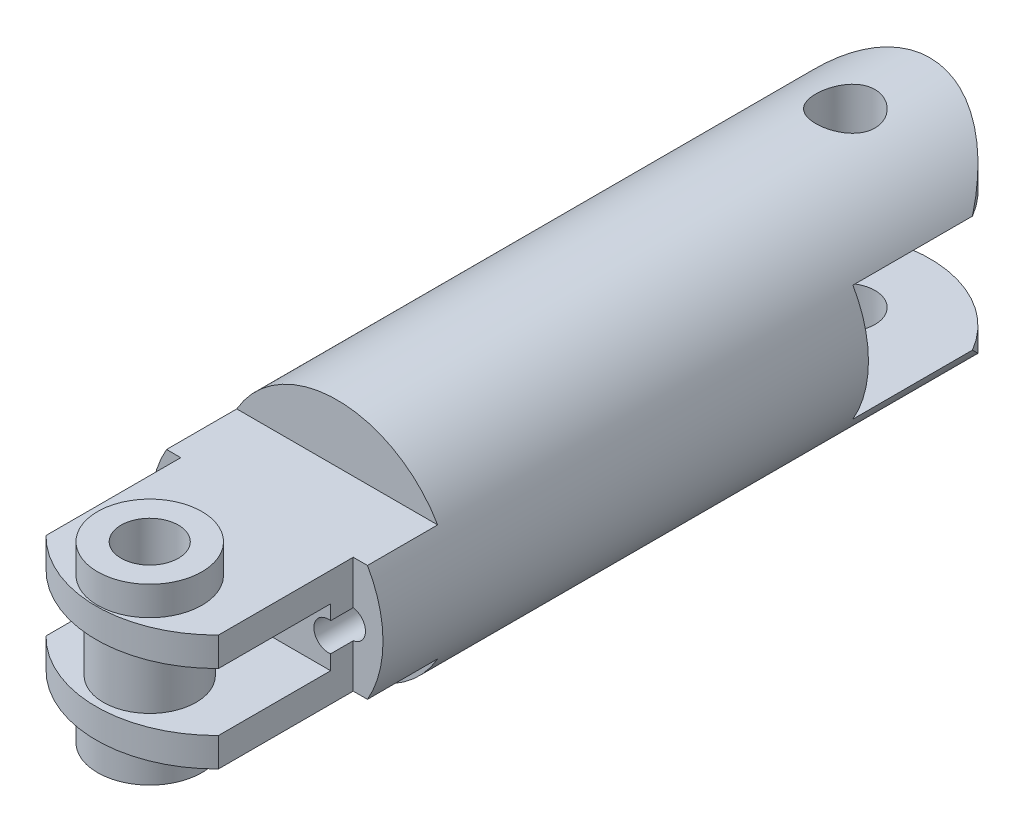
from build123d import *
from build123d.topology import SkipClean

# Parameters (mm, degrees)
SKETCH2_R                       = 10
PHALANGE_LENGTH_DEPTH           = 43.8
BOSS_EXTRUDE3_DEPTH             = 5
BOSS_EXTRUDE4_DEPTH             = 5
BOSS_EXTRUDE4_DEPTH_BACK        = 5
CUT_EXTRUDE2_START              = -15.3025
CUT_EXTRUDE2_DEPTH              = 15.3025
SKETCH7_R                       = 1.65
CUT_EXTRUDE3_DEPTH              = 10
CUT_EXTRUDE4_DEPTH              = 2.5
CUT_EXTRUDE4_DEPTH_BACK         = 2.5
CUT_EXTRUDE7_REACH              = 63.838
SKETCH4_R                       = 1.65
CUT_EXTRUDE7_DIRECTION_2_REACH  = 63.838
CUT_EXTRUDE_THIN1_START         = 43.8
CUT_EXTRUDE_THIN1_DEPTH         = 10.361670454
BOSS_EXTRUDE5_REACH             = 63.28
SKETCH9_R                       = 4
SKETCH9_R_2                     = 1.65
CUT_EXTRUDE8_REACH              = 62.771
SKETCH10_R                      = 1.25
CUT_EXTRUDE9_START              = -8
CUT_EXTRUDE9_DEPTH              = 8
CUT_EXTRUDE10_REACH             = 63.28
CUT_EXTRUDE10_DIRECTION_2_REACH = 63.28
CUT_EXTRUDE11_START             = -10
CUT_EXTRUDE11_OUTLINE_W         = 2.565773848
CUT_EXTRUDE11_OUTLINE_H         = 11.6166929
CUT_EXTRUDE11_DEPTH             = 10
BOSS_EXTRUDE6_START             = 7.5
SKETCH14_R                      = 4.5
SKETCH14_R_2                    = 1.65
BOSS_EXTRUDE6_DEPTH             = 2.5
BOSS_EXTRUDE7_START             = -7.5
SKETCH14_2_R                    = 4.5
SKETCH14_2_R_2                  = 1.65
BOSS_EXTRUDE7_DEPTH             = 2.5
SCALE1_SCALE                    = 0.666666667
CUT_EXTRUDE12_START             = -11.666667
SKETCH15_R                      = 1.65
CUT_EXTRUDE12_DEPTH             = 13.333339
CUT_EXTRUDE13_REACH             = 47.962
SKETCH16_R                      = 1.7
CUT_EXTRUDE13_DIRECTION_2_REACH = 47.962


# Read off the part's stored shape, not the designer's step: Cut-Extrude-Thin1, Cut-Extrude11
with BuildPart() as part:
    # Sketch2 → Phalange Length (new body)
    with BuildSketch(Plane.XY):
        Circle(SKETCH2_R)
    extrude(amount=PHALANGE_LENGTH_DEPTH)

    # Sketch3 → Boss-Extrude3 (add)
    with BuildSketch(Plane(origin=(0, -10, 0), x_dir=(-1, 0, 0), z_dir=(0, -1, 0))):
        with BuildLine():
            Line((-10, 5.302499701), (-10, 0))
            Line((-10, 0), (10, 0))
            Line((10, 0), (10, 5.302499701))
            ThreePointArc((10, 5.302499701), (0, 15.302499701), (-10, 5.302499701))
        make_face()
    boss_extrude3 = extrude(amount=-BOSS_EXTRUDE3_DEPTH)

    # Mirror1: Boss-Extrude3 across plane
    add(boss_extrude3.mirror(Plane.ZX))

    # Sketch5 → Boss-Extrude4 (add, two sides: drawn at the far end of the back side and taken through both)
    with BuildSketch(Plane(origin=(0, 0, 0), x_dir=(1, 0, 0), z_dir=(0, 1, 0)).offset(-BOSS_EXTRUDE4_DEPTH_BACK)):
        with BuildLine():
            Line((-10, -49.583157911), (-10, -43.8))
            Line((-10, -43.8), (10, -43.8))
            Line((10, -43.8), (10, -49.583157911))
            ThreePointArc((10, -49.583157911), (0, -59.151984156), (-10, -49.583157911))
        make_face()
    extrude(amount=BOSS_EXTRUDE4_DEPTH + BOSS_EXTRUDE4_DEPTH_BACK)

    # Sketch6 → Cut-Extrude2 (cut)
    with SkipClean():  # the faces are left unmerged after this step: merging them gives an invalid solid
        with BuildSketch(Plane.XY.offset(CUT_EXTRUDE2_START)):
            with BuildLine():
                ThreePointArc((0, 10), (5, 8.660254038), (8.660254038, 5))
                Line((8.660254038, 5), (10, 5))
                Line((10, 5), (10, 10))
                Line((10, 10), (0, 10))
            make_face()
            with BuildLine():
                Line((10, -5), (8.660254038, -5))
                ThreePointArc((8.660254038, -5), (5, -8.660254038), (0, -10))
                Line((0, -10), (10, -10))
                Line((10, -10), (10, -5))
            make_face()
            with BuildLine():
                ThreePointArc((-8.660254038, 5), (-5, 8.660254038), (0, 10))
                Line((0, 10), (-10, 10))
                Line((-10, 10), (-10, 5))
                Line((-10, 5), (-8.660254038, 5))
            make_face()
            with BuildLine():
                Line((-10, -10), (0, -10))
                ThreePointArc((0, -10), (-5, -8.660254038), (-8.660254038, -5))
                Line((-8.660254038, -5), (-10, -5))
                Line((-10, -5), (-10, -10))
            make_face()
        extrude(amount=CUT_EXTRUDE2_DEPTH, mode=Mode.SUBTRACT)

    # Sketch7 → Cut-Extrude3 (cut)
    with SkipClean():  # the faces are left unmerged after this step: merging them gives an invalid solid
        with BuildSketch(Plane(origin=(0, 5, 0), x_dir=(1, 0, 0), z_dir=(0, 1, 0))):
            with Locations(Location((0, -51.961984156, 0), (0, 0, 270))):
                Circle(SKETCH7_R)
        extrude(amount=-CUT_EXTRUDE3_DEPTH, mode=Mode.SUBTRACT)

    # Sketch5<2> → Cut-Extrude4 (cut, two sides: drawn at the far end of the back side and taken through both)
    with BuildSketch(Plane(origin=(0, 0, 0), x_dir=(1, 0, 0), z_dir=(0, 1, 0)).offset(-CUT_EXTRUDE4_DEPTH_BACK)):
        with BuildLine():
            Line((-10, -49.583157911), (-10, -43.8))
            Line((-10, -43.8), (10, -43.8))
            Line((10, -43.8), (10, -49.583157911))
            ThreePointArc((10, -49.583157911), (0, -59.151984156), (-10, -49.583157911))
        make_face()
    extrude(amount=CUT_EXTRUDE4_DEPTH + CUT_EXTRUDE4_DEPTH_BACK, mode=Mode.SUBTRACT)

    # Sketch4 → Cut-Extrude7 (cut, up to next)
    with BuildSketch(Plane(origin=(0, -5, 0), x_dir=(1, 0, 0), z_dir=(0, 1, 0)), mode=Mode.PRIVATE) as cut_extrude7_sk1:
        with Locations(Location((0, 8.010159673, 0), (0, 0, 270))):
            Circle(SKETCH4_R)
    cut_extrude7_tool1 = extrude(cut_extrude7_sk1.sketch, amount=-CUT_EXTRUDE7_REACH, mode=Mode.PRIVATE) & part.part
    add(cut_extrude7_tool1.solids().sort_by_distance((0, -5, -8.01016))[0], mode=Mode.SUBTRACT)

    # Sketch4 → Cut-Extrude7 direction 2 (cut, up to next)
    with BuildSketch(Plane(origin=(0, -5, 0), x_dir=(1, 0, 0), z_dir=(0, 1, 0)), mode=Mode.PRIVATE) as cut_extrude7_direction_2_sk1:
        with Locations(Location((0, 8.010159673, 0), (0, 0, 270))):
            Circle(SKETCH4_R)
    cut_extrude7_direction_2_tool1 = extrude(cut_extrude7_direction_2_sk1.sketch, amount=CUT_EXTRUDE7_DIRECTION_2_REACH, mode=Mode.PRIVATE) & part.part
    add(cut_extrude7_direction_2_tool1.solids().sort_by_distance((0, -5, -8.01016))[0], mode=Mode.SUBTRACT)

    # Cut-Extrude-Thin1 outline → Cut-Extrude-Thin1 (cut)
    with SkipClean():  # the faces are left unmerged after this step: merging them gives an invalid solid
        with BuildSketch(Plane.XY.offset(CUT_EXTRUDE_THIN1_START)):
            with BuildLine():
                ThreePointArc((8.660254038, 5), (9.256147934, 3.78466979), (9.682458366, 2.5))
                Line((9.682458366, 2.5), (10, 2.5))
                Line((10, 2.5), (10, 5))
                Line((10, 5), (8.660254038, 5))
            make_face()
            with BuildLine():
                Line((10, -2.5), (9.682458366, -2.5))
                ThreePointArc((9.682458366, -2.5), (9.256147934, -3.78466979), (8.660254038, -5))
                Line((8.660254038, -5), (10, -5))
                Line((10, -5), (10, -2.5))
            make_face()
            with BuildLine():
                Line((-10, 2.5), (-9.682458366, 2.5))
                ThreePointArc((-9.682458366, 2.5), (-9.256147934, 3.78466979), (-8.660254038, 5))
                Line((-8.660254038, 5), (-10, 5))
                Line((-10, 5), (-10, 2.5))
            make_face()
            with BuildLine():
                ThreePointArc((-8.660254038, -5), (-9.256147934, -3.78466979), (-9.682458366, -2.5))
                Line((-9.682458366, -2.5), (-10, -2.5))
                Line((-10, -2.5), (-10, -5))
                Line((-10, -5), (-8.660254038, -5))
            make_face()
        extrude(amount=CUT_EXTRUDE_THIN1_DEPTH, mode=Mode.SUBTRACT)

    # Sketch9 → Boss-Extrude5 (add, up to next)
    with BuildSketch(Plane.XZ.offset(-2.5), mode=Mode.PRIVATE) as boss_extrude5_sk1:
        with Locations(Location((0, 51.961984156, 0), (0, 0, 90))):
            Circle(SKETCH9_R)
        with Locations(Location((0, 51.961984156, 0), (0, 0, 90))):
            Circle(SKETCH9_R_2, mode=Mode.SUBTRACT)
    boss_extrude5_tool1 = extrude(boss_extrude5_sk1.sketch, amount=BOSS_EXTRUDE5_REACH, mode=Mode.PRIVATE) - part.part
    add(boss_extrude5_tool1.solids().sort_by_distance((0, 2.5, 48.075121))[0])

    # Sketch10 → Cut-Extrude8 (cut, up to next)
    with BuildSketch(Plane.XY.offset(43.8), mode=Mode.PRIVATE) as cut_extrude8_sk1:
        with Locations((7.239961745, 0)):
            Circle(SKETCH10_R)
    cut_extrude8_tool1 = extrude(cut_extrude8_sk1.sketch, amount=-CUT_EXTRUDE8_REACH, mode=Mode.PRIVATE) & part.part
    # Sketch10 → Cut-Extrude8 (cut, up to next)
    with BuildSketch(Plane.XY.offset(43.8), mode=Mode.PRIVATE) as cut_extrude8_sk2:
        with Locations((-7.239961745, 0)):
            Circle(SKETCH10_R)
    cut_extrude8_tool2 = extrude(cut_extrude8_sk2.sketch, amount=-CUT_EXTRUDE8_REACH, mode=Mode.PRIVATE) & part.part
    add(cut_extrude8_tool1.solids().sort_by_distance((7.239962, 0, 43.8))[0], mode=Mode.SUBTRACT)
    add(cut_extrude8_tool2.solids().sort_by_distance((-7.239962, 0, 43.8))[0], mode=Mode.SUBTRACT)

    # Sketch11 → Cut-Extrude9 (cut)
    with SkipClean():  # the faces are left unmerged after this step: merging them gives an invalid solid
        with BuildSketch(Plane.XY.offset(43.8).offset(CUT_EXTRUDE9_START)):
            with BuildLine():
                ThreePointArc((8.660254038, 5), (0, 10), (-8.660254038, 5))
                Line((-8.660254038, 5), (8.660254038, 5))
            make_face()
            with BuildLine():
                Line((8.660254038, -5), (-8.660254038, -5))
                ThreePointArc((-8.660254038, -5), (0, -10), (8.660254038, -5))
            make_face()
        extrude(amount=CUT_EXTRUDE9_DEPTH, mode=Mode.SUBTRACT)

    # Sketch12 → Cut-Extrude10 (cut, up to next)
    with BuildSketch(Plane.XZ.offset(-2.5), mode=Mode.PRIVATE) as cut_extrude10_sk1:
        with BuildLine():
            ThreePointArc((0, 59.151984156), (-5.99753031, 57.15625831), (-9.603498629, 51.964892021))
            Line((-9.603498629, 51.964892021), (-8.660254038, 51.964892021))
            ThreePointArc((-8.660254038, 51.964892021), (0, 56.590740593), (8.660254038, 51.964892021))
            Line((8.660254038, 51.964892021), (9.603498629, 51.964892021))
            ThreePointArc((9.603498629, 51.964892021), (5.99753031, 57.15625831), (0, 59.151984156))
        make_face()
    cut_extrude10_tool1 = extrude(cut_extrude10_sk1.sketch, amount=CUT_EXTRUDE10_REACH, mode=Mode.PRIVATE) & part.part
    add(cut_extrude10_tool1.solids().sort_by_distance((5.874655, 2.5, 56.99207))[0], mode=Mode.SUBTRACT)

    # Sketch12 → Cut-Extrude10 direction 2 (cut, up to next)
    with BuildSketch(Plane.XZ.offset(-2.5), mode=Mode.PRIVATE) as cut_extrude10_direction_2_sk1:
        with BuildLine():
            ThreePointArc((0, 59.151984156), (-5.99753031, 57.15625831), (-9.603498629, 51.964892021))
            Line((-9.603498629, 51.964892021), (-8.660254038, 51.964892021))
            ThreePointArc((-8.660254038, 51.964892021), (0, 56.590740593), (8.660254038, 51.964892021))
            Line((8.660254038, 51.964892021), (9.603498629, 51.964892021))
            ThreePointArc((9.603498629, 51.964892021), (5.99753031, 57.15625831), (0, 59.151984156))
        make_face()
    cut_extrude10_direction_2_tool1 = extrude(cut_extrude10_direction_2_sk1.sketch, amount=-CUT_EXTRUDE10_DIRECTION_2_REACH, mode=Mode.PRIVATE) & part.part
    add(cut_extrude10_direction_2_tool1.solids().sort_by_distance((5.874655, 2.5, 56.99207))[0], mode=Mode.SUBTRACT)

    # Cut-Extrude11 outline → Cut-Extrude11 (cut)
    with BuildSketch(Plane.XZ.offset(5).offset(CUT_EXTRUDE11_START)):
        with Locations((-8.717113076, 47.660571369)):
            Rectangle(CUT_EXTRUDE11_OUTLINE_W, CUT_EXTRUDE11_OUTLINE_H)
        with Locations((8.717113076, 47.660571369)):
            Rectangle(CUT_EXTRUDE11_OUTLINE_W, CUT_EXTRUDE11_OUTLINE_H)
    extrude(amount=CUT_EXTRUDE11_DEPTH, mode=Mode.SUBTRACT)

    # Sketch14 → Boss-Extrude6 (add)
    with SkipClean():  # the faces are left unmerged after this step: merging them gives an invalid solid
        with BuildSketch(Plane(origin=(0, 0, 0), x_dir=(1, 0, 0), z_dir=(0, 1, 0)).offset(BOSS_EXTRUDE6_START)):
            with Locations(Location((0, -51.961984156, 0), (0, 0, 270))):
                Circle(SKETCH14_R)
            with Locations(Location((0, -51.961984156, 0), (0, 0, 270))):
                Circle(SKETCH14_R_2, mode=Mode.SUBTRACT)
        extrude(amount=-BOSS_EXTRUDE6_DEPTH)

    # Sketch14<2> → Boss-Extrude7 (add)
    with SkipClean():  # the faces are left unmerged after this step: merging them gives an invalid solid
        with BuildSketch(Plane(origin=(0, 0, 0), x_dir=(1, 0, 0), z_dir=(0, 1, 0)).offset(BOSS_EXTRUDE7_START)):
            with Locations(Location((0, -51.961984156, 0), (0, 0, 270))):
                Circle(SKETCH14_2_R)
            with Locations(Location((0, -51.961984156, 0), (0, 0, 270))):
                Circle(SKETCH14_2_R_2, mode=Mode.SUBTRACT)
        extrude(amount=BOSS_EXTRUDE7_DEPTH)


with BuildPart() as part_1:
    # Scale1: scaled about (0, 4.7e-08, 19.907417167)
    add(part.part.scale(SCALE1_SCALE).moved(Location((0, 1.6e-08, 6.635805722))))

    # Sketch15 → Cut-Extrude12 (cut)
    with BuildSketch(Plane(origin=(0, 4.999994984, 0), x_dir=(1, 0, 0), z_dir=(0, 1, 0)).offset(CUT_EXTRUDE12_START)):
        with Locations(Location((-4.7e-08, -41.277297094, 0), (0, 0, 270))):
            Circle(SKETCH15_R)
    extrude(amount=CUT_EXTRUDE12_DEPTH, mode=Mode.SUBTRACT)

    # Sketch16 → Cut-Extrude13 (cut, up to next)
    with BuildSketch(Plane.XZ.offset(-3.333328317), mode=Mode.PRIVATE) as cut_extrude13_sk1:
        with Locations(Location((-4.7e-08, 1.295867875, 0), (0, 0, 270))):
            Circle(SKETCH16_R)
    cut_extrude13_tool1 = extrude(cut_extrude13_sk1.sketch, amount=-CUT_EXTRUDE13_REACH, mode=Mode.PRIVATE) & part_1.part
    add(cut_extrude13_tool1.solids().sort_by_distance((0, 3.333328, 1.295868))[0], mode=Mode.SUBTRACT)

    # Sketch16 → Cut-Extrude13 direction 2 (cut, up to next)
    with BuildSketch(Plane.XZ.offset(-3.333328317), mode=Mode.PRIVATE) as cut_extrude13_direction_2_sk1:
        with Locations(Location((-4.7e-08, 1.295867875, 0), (0, 0, 270))):
            Circle(SKETCH16_R)
    cut_extrude13_direction_2_tool1 = extrude(cut_extrude13_direction_2_sk1.sketch, amount=CUT_EXTRUDE13_DIRECTION_2_REACH, mode=Mode.PRIVATE) & part_1.part
    add(cut_extrude13_direction_2_tool1.solids().sort_by_distance((0, 3.333328, 1.295868))[0], mode=Mode.SUBTRACT)


solid = part_1.part
